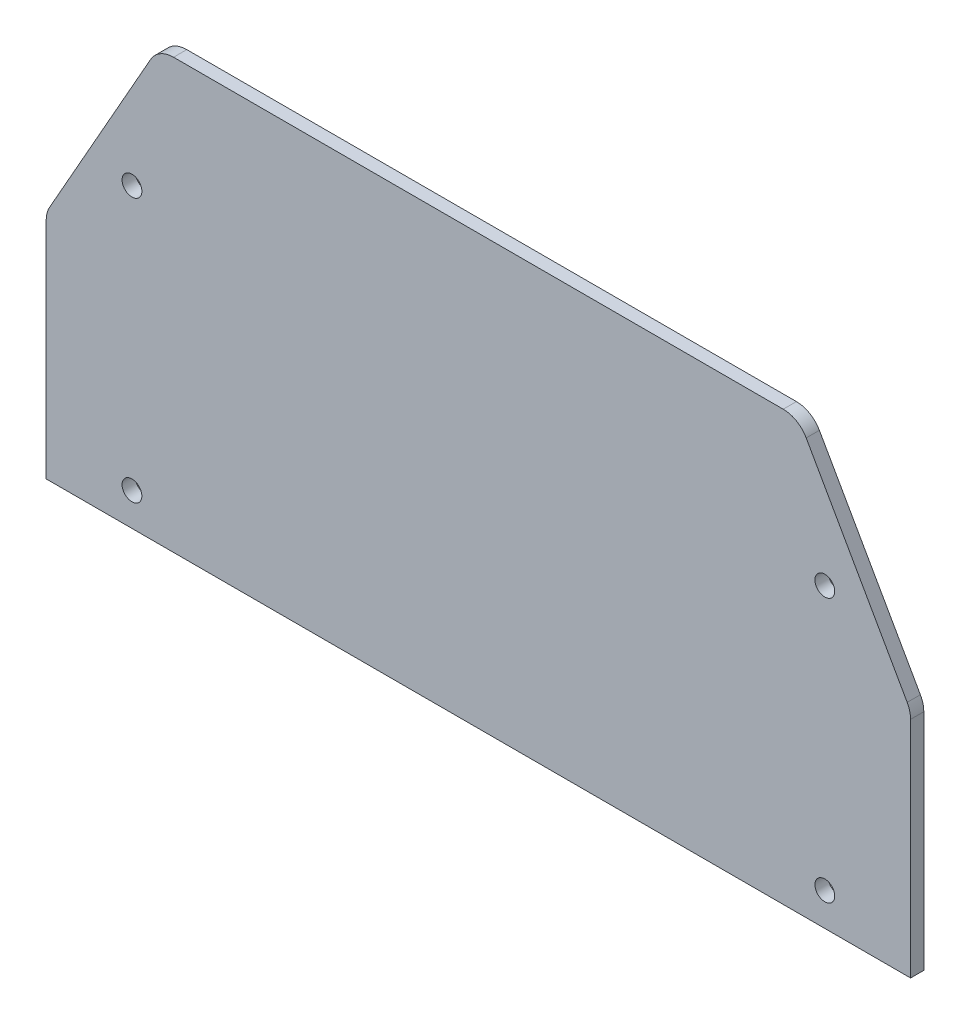
from build123d import *

# Parameters (mm, degrees)
ESQUISSE1_R               = 1.5
T_LE_DE_BASE_PLI_E1_DEPTH = 2
CONG_1_R                  = 4


# Sheet-metal steps are written as plain solids
with BuildPart() as part:
    # Esquisse1 → Tôle de base pliée1 (new body)
    with BuildSketch(Plane.XY):
        Polygon((-48.526816654, 65), (-65.5, 35), (-65.5, 0), (65.5, 0), (65.5, 35), (48.526816654, 65), align=None)
        with Locations((-52.5, 45)):
            Circle(ESQUISSE1_R, mode=Mode.SUBTRACT)
        with Locations((-52.5, 5)):
            Circle(ESQUISSE1_R, mode=Mode.SUBTRACT)
        with Locations(Location((52.5, 5, 0), (0, 0, 180))):
            Circle(ESQUISSE1_R, mode=Mode.SUBTRACT)
        with Locations(Location((52.5, 45, 0), (0, 0, 180))):
            Circle(ESQUISSE1_R, mode=Mode.SUBTRACT)
    extrude(amount=-T_LE_DE_BASE_PLI_E1_DEPTH)

    # Congé1
    cong_1_edges = [part.edges().sort_by_distance(p)[0] for p in [
        (-65.5, 35, -1),
        (-48.526816654, 65, -1),
        (48.526816654, 65, -1),
        (65.5, 35, -1),
    ]]
    fillet(cong_1_edges, radius=CONG_1_R)


solid = part.part
